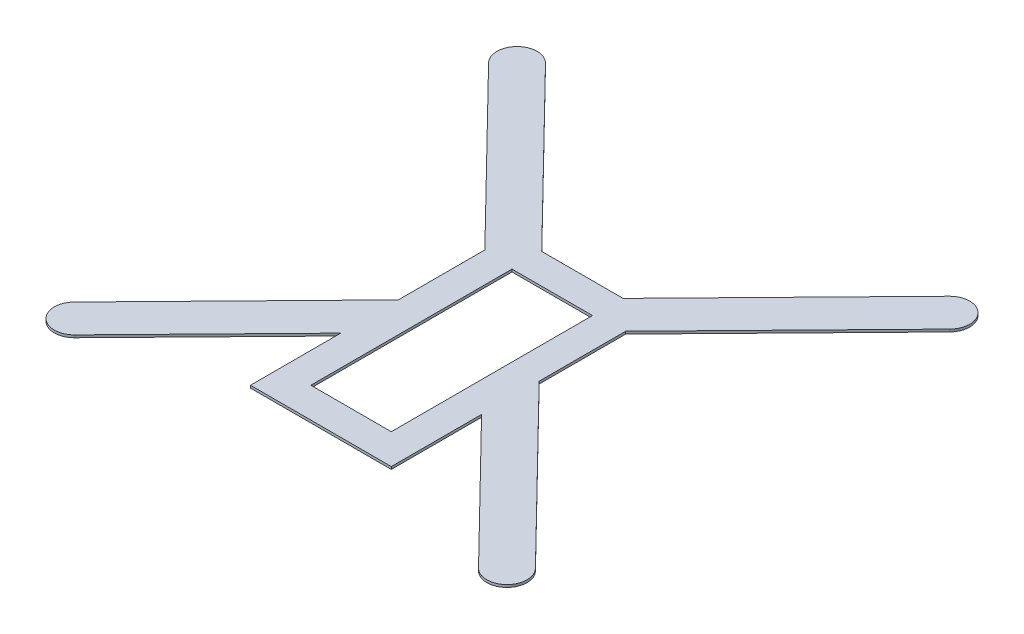
from build123d import *

# Parameters (mm, degrees)
SKETCH2_W           = 50.8
SKETCH2_H           = 127
BOSS_EXTRUDE1_DEPTH = 0.79375


with BuildPart() as part:
    # Sketch2 → Boss-Extrude1 (new, symmetric)
    with BuildSketch(Plane(origin=(0, 0, 0), x_dir=(1, 0, 0), z_dir=(0, 1, 0))):
        with BuildLine():
            Line((-25.682184284, 44.45), (-127.44212253, 148.576448437))
            ThreePointArc((-127.44212253, 148.576448437), (-145.401448437, 148.78287747), (-145.60787747, 130.823551563))
            Line((-145.60787747, 130.823551563), (-44.45, 27.313165314))
            Line((-44.45, 27.313165314), (-44.45, -27.313165314))
            Line((-44.45, -27.313165314), (-145.60787747, -130.823551563))
            ThreePointArc((-145.60787747, -130.823551563), (-145.401448437, -148.78287747), (-127.44212253, -148.576448437))
            Line((-127.44212253, -148.576448437), (-44.45, -63.654276546))
            Line((-44.45, -63.654276546), (-44.45, -120.65))
            Line((-44.45, -120.65), (44.45, -120.65))
            Line((44.45, -120.65), (44.45, -63.654276546))
            Line((44.45, -63.654276546), (127.44212253, -148.576448437))
            ThreePointArc((127.44212253, -148.576448437), (145.401448437, -148.78287747), (145.60787747, -130.823551563))
            Line((145.60787747, -130.823551563), (44.45, -27.313165314))
            Line((44.45, -27.313165314), (44.45, 27.313165314))
            Line((44.45, 27.313165314), (145.60787747, 130.823551563))
            ThreePointArc((145.60787747, 130.823551563), (145.401448437, 148.78287747), (127.44212253, 148.576448437))
            Line((127.44212253, 148.576448437), (25.682184284, 44.45))
            Line((25.682184284, 44.45), (-25.682184284, 44.45))
        make_face()
        with Locations((0, -38.1)):
            Rectangle(SKETCH2_W, SKETCH2_H, mode=Mode.SUBTRACT)
    extrude(amount=BOSS_EXTRUDE1_DEPTH, both=True)


solid = part.part
